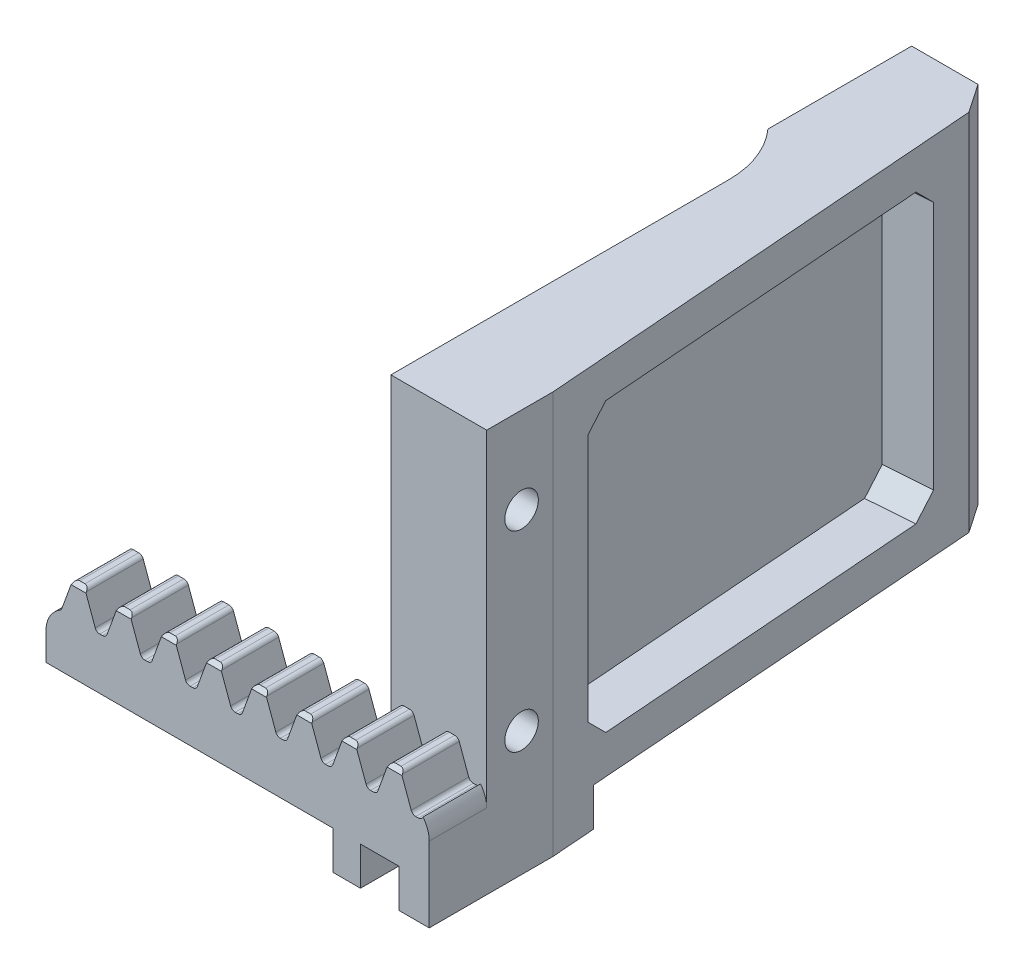
from build123d import *

# Parameters (mm, degrees)
BOSS_EXTRUDE1_DEPTH      = 7.5
BOSS_EXTRUDE1_DEPTH_BACK = 7.5
SKETCH3_W                = 200
SKETCH3_H                = 15
CUT_EXTRUDE1_DEPTH       = 101.560926806
FILLET1_R                = 0.503257554
LPATTERN1_COUNT          = 42
LPATTERN1_PITCH          = 4.71238898
FILLET1_OF_LPATTERN1_R   = 0.503257554
CUT_EXTRUDE2_DEPTH       = 101.560926806
CUT_EXTRUDE2_DEPTH_BACK  = 101.560926806
SKETCH5_W                = 4.71238898
SKETCH5_H                = 3.375
CUT_EXTRUDE3_DEPTH       = 101.560926806
CUT_EXTRUDE3_DEPTH_BACK  = 101.560926806
SKETCH6_W                = 13.890612777
SKETCH6_H                = 21.950597968
CUT_EXTRUDE6_DEPTH       = 101.560926806
CUT_EXTRUDE6_DEPTH_BACK  = 101.560926806
SKETCH8_W                = 175.100830171
SKETCH8_H                = 44.946806771
SKETCH9_W                = 55.501850732
SKETCH9_H                = 10.784038355
CUT_EXTRUDE7_DEPTH       = 101.560926806
SKETCH10_W               = 10
SKETCH10_H               = 38
BOSS_EXTRUDE2_DEPTH      = 6.9
SKETCH11_W               = 12.54
SKETCH11_H               = 38
BOSS_EXTRUDE3_DEPTH      = 50
SKETCH12_W               = 2.54
SKETCH12_H               = 35
CUT_EXTRUDE8_DEPTH       = 121.701325593
CHAMFER1_SIZE            = 3
CHAMFER1_SIZE2           = 1.816762814
FILLET2_R                = 10
SKETCH13_W               = 39.144192087
SKETCH13_H               = 30
CUT_EXTRUDE9_DEPTH       = 5
CHAMFER2_SIZE            = 2
SKETCH14_R               = 1.75
CUT_EXTRUDE10_DEPTH      = 78.944675893
BOSS_EXTRUDE4_DEPTH      = 4
BOSS_EXTRUDE4_DEPTH_BACK = 1
FILLET3_R                = 0.25
SKETCH16_W               = 73.039939744
SKETCH16_H               = 56.96380351
CUT_EXTRUDE11_DEPTH      = 0.5
FILLET5_R                = 3
CUT_EXTRUDE12_DEPTH      = 78.944675893
CUT_EXTRUDE12_DEPTH_BACK = 78.944675893


with BuildPart() as part:
    # Sketch3 → Boss-Extrude1 (new, two sides: drawn at the far end of the back side and taken through both)
    with BuildSketch(Plane.XY.offset(-BOSS_EXTRUDE1_DEPTH_BACK)):
        Rectangle(SKETCH3_W, SKETCH3_H)
    extrude(amount=BOSS_EXTRUDE1_DEPTH + BOSS_EXTRUDE1_DEPTH_BACK)

    # Sketch4 → Cut-Extrude1 (cut, symmetric)
    with BuildSketch(Plane.XY):
        Polygon((-94.247779608, 7.5), (-94.247779608, 4.125), (-94.743432664, 4.125), (-95.971832204, 7.5), align=None)
        Polygon((-97.236115992, 7.5), (-98.464515532, 4.125), (-98.960168588, 4.125), (-98.960168588, 7.5), align=None)
    cut_extrude1 = extrude(amount=CUT_EXTRUDE1_DEPTH, both=True, mode=Mode.SUBTRACT)

    # Fillet1
    fillet1_edges = [part.edges().sort_by_distance(p)[0] for p in [
        (-95.971832204, 7.5, 0),
        (-94.743432664, 4.125, 0),
        (-97.236115992, 7.5, 0),
        (-98.464515532, 4.125, 0),
    ]]
    fillet(fillet1_edges, radius=FILLET1_R)

    # LPattern1: Cut-Extrude1 ×42
    with Locations(*[(i * LPATTERN1_PITCH, 0, 0) for i in range(1, LPATTERN1_COUNT)]):
        add(cut_extrude1, mode=Mode.SUBTRACT)

    # Fillet1 of LPattern1
    fillet1_of_lpattern1_edges = [part.edges().sort_by_distance(p)[0] for p in [
        (-91.259443224, 7.5, 0),
        (-90.031043683, 4.125, 0),
        (-92.523727011, 7.5, 0),
        (-93.752126552, 4.125, 0),
        (-86.547054243, 7.5, 0),
        (-85.318654703, 4.125, 0),
        (-87.811338031, 7.5, 0),
        (-89.039737571, 4.125, 0),
        (-81.834665263, 7.5, 0),
        (-80.606265722, 4.125, 0),
        (-83.09894905, 7.5, 0),
        (-84.327348591, 4.125, 0),
        (-77.122276283, 7.5, 0),
        (-75.893876742, 4.125, 0),
        (-78.38656007, 7.5, 0),
        (-79.614959611, 4.125, 0),
        (-72.409887302, 7.5, 0),
        (-71.181487762, 4.125, 0),
        (-73.67417109, 7.5, 0),
        (-74.90257063, 4.125, 0),
        (-67.697498322, 7.5, 0),
        (-66.469098781, 4.125, 0),
        (-68.961782109, 7.5, 0),
        (-70.19018165, 4.125, 0),
        (-62.985109342, 7.5, 0),
        (-61.756709801, 4.125, 0),
        (-64.249393129, 7.5, 0),
        (-65.47779267, 4.125, 0),
        (-58.272720361, 7.5, 0),
        (-57.04432082, 4.125, 0),
        (-59.537004149, 7.5, 0),
        (-60.765403689, 4.125, 0),
        (-53.560331381, 7.5, 0),
        (-52.33193184, 4.125, 0),
        (-54.824615168, 7.5, 0),
        (-56.053014709, 4.125, 0),
        (-48.8479424, 7.5, 0),
        (-47.61954286, 4.125, 0),
        (-50.112226188, 7.5, 0),
        (-51.340625728, 4.125, 0),
        (-44.13555342, 7.5, 0),
        (-42.907153879, 4.125, 0),
        (-45.399837207, 7.5, 0),
        (-46.628236748, 4.125, 0),
        (-39.42316444, 7.5, 0),
        (-38.194764899, 4.125, 0),
        (-40.687448227, 7.5, 0),
        (-41.915847768, 4.125, 0),
        (-34.710775459, 7.5, 0),
        (-33.482375919, 4.125, 0),
        (-35.975059247, 7.5, 0),
        (-37.203458787, 4.125, 0),
        (-29.998386479, 7.5, 0),
        (-28.769986938, 4.125, 0),
        (-31.262670266, 7.5, 0),
        (-32.491069807, 4.125, 0),
        (-25.285997498, 7.5, 0),
        (-24.057597958, 4.125, 0),
        (-26.550281286, 7.5, 0),
        (-27.778680826, 4.125, 0),
        (-20.573608518, 7.5, 0),
        (-19.345208977, 4.125, 0),
        (-21.837892305, 7.5, 0),
        (-23.066291846, 4.125, 0),
        (-15.861219538, 7.5, 0),
        (-14.632819997, 4.125, 0),
        (-17.125503325, 7.5, 0),
        (-18.353902866, 4.125, 0),
        (-11.148830557, 7.5, 0),
        (-9.920431017, 4.125, 0),
        (-12.413114345, 7.5, 0),
        (-13.641513885, 4.125, 0),
        (-6.436441577, 7.5, 0),
        (-5.208042036, 4.125, 0),
        (-7.700725364, 7.5, 0),
        (-8.929124905, 4.125, 0),
        (-1.724052597, 7.5, 0),
        (-0.495653056, 4.125, 0),
        (-2.988336384, 7.5, 0),
        (-4.216735925, 4.125, 0),
        (2.988336384, 7.5, 0),
        (4.216735925, 4.125, 0),
        (1.724052596, 7.5, 0),
        (0.495653056, 4.125, 0),
        (7.700725364, 7.5, 0),
        (8.929124905, 4.125, 0),
        (6.436441577, 7.5, 0),
        (5.208042036, 4.125, 0),
        (12.413114345, 7.5, 0),
        (13.641513885, 4.125, 0),
        (11.148830557, 7.5, 0),
        (9.920431017, 4.125, 0),
        (17.125503325, 7.5, 0),
        (18.353902866, 4.125, 0),
        (15.861219538, 7.5, 0),
        (14.632819997, 4.125, 0),
        (21.837892305, 7.5, 0),
        (23.066291846, 4.125, 0),
        (20.573608518, 7.5, 0),
        (19.345208977, 4.125, 0),
        (26.550281286, 7.5, 0),
        (27.778680826, 4.125, 0),
        (25.285997498, 7.5, 0),
        (24.057597958, 4.125, 0),
        (31.262670266, 7.5, 0),
        (32.491069807, 4.125, 0),
        (29.998386479, 7.5, 0),
        (28.769986938, 4.125, 0),
        (35.975059247, 7.5, 0),
        (37.203458787, 4.125, 0),
        (34.710775459, 7.5, 0),
        (33.482375919, 4.125, 0),
        (40.687448227, 7.5, 0),
        (41.915847768, 4.125, 0),
        (39.42316444, 7.5, 0),
        (38.194764899, 4.125, 0),
        (45.399837207, 7.5, 0),
        (46.628236748, 4.125, 0),
        (44.13555342, 7.5, 0),
        (42.907153879, 4.125, 0),
        (50.112226188, 7.5, 0),
        (51.340625728, 4.125, 0),
        (48.8479424, 7.5, 0),
        (47.61954286, 4.125, 0),
        (54.824615168, 7.5, 0),
        (56.053014709, 4.125, 0),
        (53.560331381, 7.5, 0),
        (52.33193184, 4.125, 0),
        (59.537004148, 7.5, 0),
        (60.765403689, 4.125, 0),
        (58.272720361, 7.5, 0),
        (57.04432082, 4.125, 0),
        (64.249393129, 7.5, 0),
        (65.47779267, 4.125, 0),
        (62.985109341, 7.5, 0),
        (61.756709801, 4.125, 0),
        (68.961782109, 7.5, 0),
        (70.19018165, 4.125, 0),
        (67.697498322, 7.5, 0),
        (66.469098781, 4.125, 0),
        (73.67417109, 7.5, 0),
        (74.90257063, 4.125, 0),
        (72.409887302, 7.5, 0),
        (71.181487762, 4.125, 0),
        (78.38656007, 7.5, 0),
        (79.614959611, 4.125, 0),
        (77.122276283, 7.5, 0),
        (75.893876742, 4.125, 0),
        (83.09894905, 7.5, 0),
        (84.327348591, 4.125, 0),
        (81.834665263, 7.5, 0),
        (80.606265722, 4.125, 0),
        (87.811338031, 7.5, 0),
        (89.039737571, 4.125, 0),
        (86.547054243, 7.5, 0),
        (85.318654703, 4.125, 0),
        (92.523727011, 7.5, 0),
        (93.752126552, 4.125, 0),
        (91.259443224, 7.5, 0),
        (90.031043683, 4.125, 0),
        (97.236115992, 7.5, 0),
        (98.464515532, 4.125, 0),
        (95.971832204, 7.5, 0),
        (94.743432664, 4.125, 0),
    ]]
    fillet(fillet1_of_lpattern1_edges, radius=FILLET1_OF_LPATTERN1_R)

    # Sketch5 → Cut-Extrude2 (cut, two sides: drawn at the far end of the back side and taken through both)
    with BuildSketch(Plane.XY.offset(-CUT_EXTRUDE2_DEPTH_BACK)):
        with Locations((-101.316363078, 5.8125)):
            Rectangle(SKETCH5_W, SKETCH5_H)
        with Locations((101.316363078, 5.8125)):
            Rectangle(SKETCH5_W, SKETCH5_H)
    extrude(amount=CUT_EXTRUDE2_DEPTH + CUT_EXTRUDE2_DEPTH_BACK, mode=Mode.SUBTRACT)

    # Sketch6 → Cut-Extrude3 (cut, two sides: drawn at the far end of the back side and taken through both)
    with BuildSketch(Plane(origin=(0, 0, 0), x_dir=(0, 0, -1), z_dir=(1, 0, 0)).offset(-CUT_EXTRUDE3_DEPTH_BACK)):
        with Locations((5.945306389, -0.750264579)):
            Rectangle(SKETCH6_W, SKETCH6_H)
    extrude(amount=CUT_EXTRUDE3_DEPTH + CUT_EXTRUDE3_DEPTH_BACK, mode=Mode.SUBTRACT)

    # Sketch8 → Cut-Extrude6 (cut, two sides: drawn at the far end of the back side and taken through both)
    with BuildSketch(Plane.XY.offset(-CUT_EXTRUDE6_DEPTH_BACK)):
        with Locations((27.550415086, 7.242613414)):
            Rectangle(SKETCH8_W, SKETCH8_H)
    extrude(amount=CUT_EXTRUDE6_DEPTH + CUT_EXTRUDE6_DEPTH_BACK, mode=Mode.SUBTRACT)

    # Sketch9 → Cut-Extrude7 (cut, through all)
    with BuildSketch(Plane.XY):
        with Locations((-76.828993169, -6.642019178)):
            Rectangle(SKETCH9_W, SKETCH9_H)
    extrude(amount=CUT_EXTRUDE7_DEPTH, mode=Mode.SUBTRACT)

    # Sketch10 → Boss-Extrude2 (add)
    with BuildSketch(Plane(origin=(0, 0, 1), x_dir=(-1, 0, 0), z_dir=(0, 0, -1))):
        with Locations((65, 17.75)):
            Rectangle(SKETCH10_W, SKETCH10_H)
    extrude(amount=BOSS_EXTRUDE2_DEPTH)

    # Sketch11 → Boss-Extrude3 (add)
    with BuildSketch(Plane(origin=(0, 0, -5.9), x_dir=(-1, 0, 0), z_dir=(0, 0, -1))):
        with Locations((66.27, 17.75)):
            Rectangle(SKETCH11_W, SKETCH11_H)
    extrude(amount=BOSS_EXTRUDE3_DEPTH)

    # Sketch12 → Cut-Extrude8 (cut, through all)
    with BuildSketch(Plane.XZ.offset(1.25)):
        with Locations((-71.27, -23.4)):
            Rectangle(SKETCH12_W, SKETCH12_H)
        Polygon((-60, -5.9), (-63.8, -55.9), (-60, -55.9), align=None)
    extrude(amount=-CUT_EXTRUDE8_DEPTH, mode=Mode.SUBTRACT)

    # Chamfer1
    chamfer1_edges = [part.edges().sort_by_distance(p)[0] for p in [
        (-63.8, 17.75, -55.9),
    ]]
    chamfer1_side = [part.faces().sort_by_distance(p)[0] for p in [
        (-61.9, 17.75, -30.9),
    ]]
    chamfer(chamfer1_edges, length=CHAMFER1_SIZE, length2=CHAMFER1_SIZE2, reference=chamfer1_side[0])

    # Fillet2
    # the kernel refuses this fillet: 10 mm, written as the material it adds along each edge
    with BuildSketch(Plane(origin=(-70, -1.25, -40.9), x_dir=(-1, 0, 0), z_dir=(0, 1, 0))) as fillet2_piece_1:
        with BuildLine():
            CenterArc((10, 6.659459438), FILLET2_R, 180, 41.754936598)
            Line((0, 6.659459438), (-0.2, 6.659459438))
            Line((-0.2, 6.659459438), (-0.2, 0))
            Line((-0.2, 0), (0, -0.2))
            ThreePointArc((0, -0.2), (1.27, -0.2), (2.3908, -0.133189189))
            Line((2.3908, -0.133189189), (2.54, 0))
        make_face()
    extrude(amount=38)

    # Sketch13 → Cut-Extrude9 (cut)
    with BuildSketch(Plane(origin=(-59.20960532, 0, 4.499930004), x_dir=(-0.07578145826840343, 0, -0.997124450900044), z_dir=(0.997124450900044, 0, -0.07578145826840343))):
        with Locations((34.0020178, 17.75)):
            Rectangle(SKETCH13_W, SKETCH13_H)
    extrude(amount=-CUT_EXTRUDE9_DEPTH, mode=Mode.SUBTRACT)

    # Chamfer2
    chamfer2_edges = [part.edges().sort_by_distance(p)[0] for p in [
        (-62.79593696, 2.75, -9.699044158),
        (-62.79593696, 32.75, -9.699044158),
        (-65.762340919, 32.75, -48.730675198),
        (-65.762340919, 2.75, -48.730675198),
    ]]
    chamfer(chamfer2_edges, length=CHAMFER2_SIZE)

    # Sketch14 → Cut-Extrude10 (cut, through all)
    with BuildSketch(Plane(origin=(-60, 0, 0), x_dir=(0, 0, -1), z_dir=(1, 0, 0))):
        with Locations(Location((2.64, 27.75, 0), (0, 0, 90))):
            Circle(SKETCH14_R)
        with Locations(Location((2.64, 7.75, 0), (0, 0, 90))):
            Circle(SKETCH14_R)
    extrude(amount=-CUT_EXTRUDE10_DEPTH, mode=Mode.SUBTRACT)

    # Sketch15 → Boss-Extrude4 (add, two sides: drawn at the far end of the back side and taken through both)
    with BuildSketch(Plane.XZ.offset(1.25).offset(-BOSS_EXTRUDE4_DEPTH_BACK)):
        Polygon((-70.069658973, 7.5), (-70, -10.5), (-67.1748, -10.5), (-67.1748, 7.5), align=None)
        Polygon((-60, -5.9), (-60, 7.5), (-63.1748, 7.5), (-63.1748, -10.5), (-60.3496, -10.5), align=None)
    extrude(amount=BOSS_EXTRUDE4_DEPTH + BOSS_EXTRUDE4_DEPTH_BACK)

    # Fillet3
    fillet3_edges = [part.edges().sort_by_distance(p)[0] for p in [
        (-67.1748, -3.25, 7.5),
        (-67.1748, -3.25, -10.5),
        (-63.1748, -3.25, -10.5),
        (-63.1748, -3.25, 7.5),
    ]]
    fillet(fillet3_edges, radius=FILLET3_R)

    # Sketch16 → Cut-Extrude11 (cut)
    with BuildSketch(Plane.XY.offset(7.5)):
        with Locations((-72.750010193, 7.574608655)):
            Rectangle(SKETCH16_W, SKETCH16_H)
    extrude(amount=-CUT_EXTRUDE11_DEPTH, mode=Mode.SUBTRACT)

    # Fillet5
    # the kernel refuses this fillet: 3 mm, written as the material it takes off along each edge
    with BuildSketch(Plane(origin=(-100, 4.125, -5.230049704), x_dir=(0.9987257002687598, 0.05046757000961256, 0), z_dir=(0, 0, 1))) as fillet5_piece_1:
        with BuildLine():
            CenterArc((2.870410913, -2.640247011), FILLET5_R, 118.347702704, 58.759489659)
            Line((-0.125766188, -2.488844301), (-0.425383898, -2.47370403))
            Line((-0.425383898, -2.47370403), (-0.29961771, 0.015140271))
            Line((-0.29961771, 0.015140271), (0.015140271, 0.29961771))
            ThreePointArc((0.015140271, 0.29961771), (1.196732382, 0.239909541), (1.303501273, 0.264024701))
            Line((1.303501273, 0.264024701), (1.445947604, 0))
        make_face()
    extrude(amount=18.460099408, mode=Mode.SUBTRACT)
    with BuildSketch(Plane(origin=(-60, 6.227929353, 1), x_dir=(0, -1, 0), z_dir=(0, 0, 1))) as fillet5_piece_2:
        with BuildLine():
            CenterArc((3.630132521, -3), FILLET5_R, 90, 38.275653288)
            Line((1.77179602, -0.644881012), (0, 0))
            Line((0, 0), (3.630132521, 0))
        make_face()
    extrude(amount=15.075331304, mode=Mode.SUBTRACT)

    # Sketch17 → Cut-Extrude12 (cut, two sides: drawn at the far end of the back side and taken through both)
    with BuildSketch(Plane.ZY.offset(100).offset(-CUT_EXTRUDE12_DEPTH_BACK)):
        Polygon((6.6, 7.5), (7, 7.1), (7, 7.5), align=None)
    extrude(amount=CUT_EXTRUDE12_DEPTH + CUT_EXTRUDE12_DEPTH_BACK, mode=Mode.SUBTRACT)


solid = part.part
